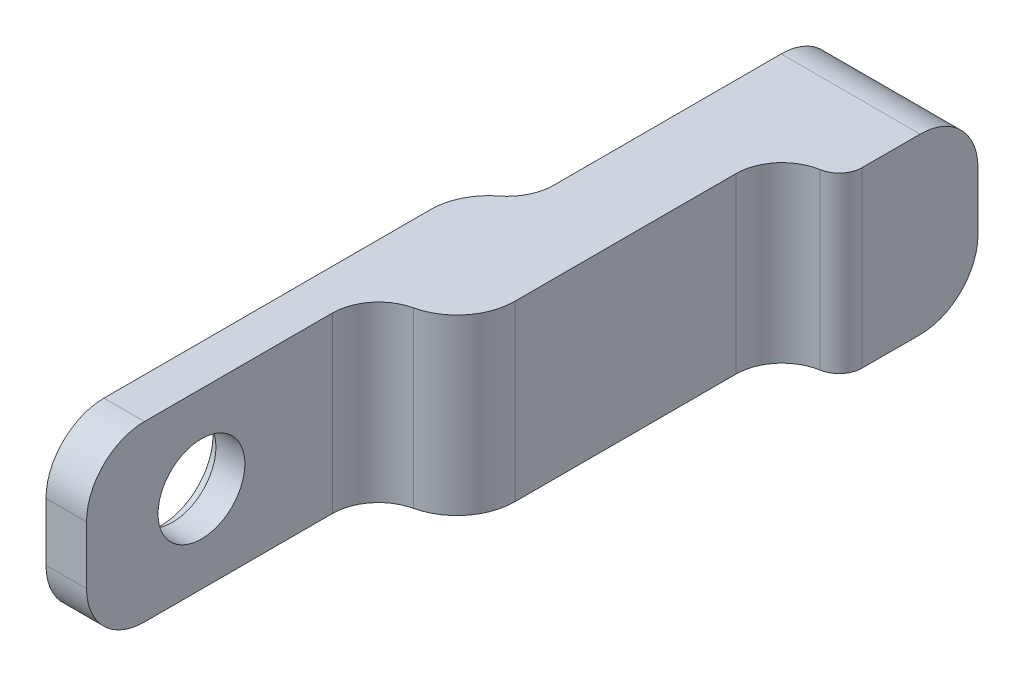
from build123d import *

# Parameters (mm, degrees)
BOSS_EXTRUDE1_DEPTH      = 11
BOSS_EXTRUDE1_DEPTH_BACK = 4
CUT_EXTRUDE1_OUTLINE_R   = 3.25
CUT_EXTRUDE1_DEPTH       = 10
CUT_EXTRUDE3_START       = -3.5
CUT_EXTRUDE3_OUTLINE_R   = 4.5
CUT_EXTRUDE3_DEPTH       = 1
CUT_EXTRUDE4_REACH       = 64.7
SKETCH5_R                = 3.75
CUT_EXTRUDE5_DEPTH       = 2.5
FILLET1_R                = 5
FILLET2_R                = 5
FILLET3_R                = 5
FILLET4_R                = 2
FILLET5_R                = 4
FILLET6_R                = 4


# Read off the part's stored shape, not the designer's step: Cut-Extrude1, Cut-Extrude3
with BuildPart() as part:
    # Sketch2 → Boss-Extrude1 (new, two sides: drawn at the far end of the back side and taken through both)
    with BuildSketch(Plane(origin=(0, 0, 0), x_dir=(1, 0, 0), z_dir=(0, 1, 0)).offset(-BOSS_EXTRUDE1_DEPTH_BACK)):
        Polygon((0, 5), (0, -22), (-3.5, -22), (-3.5, -60), (0, -60), (0, -35), (7, -35), (7, -7), (12, -7), (12, 5), align=None)
    extrude(amount=BOSS_EXTRUDE1_DEPTH + BOSS_EXTRUDE1_DEPTH_BACK)

    # Cut-Extrude1 outline → Cut-Extrude1 (cut)
    with BuildSketch(Plane.YZ):
        with Locations((3.5, 3.5)):
            Circle(CUT_EXTRUDE1_OUTLINE_R)
    extrude(amount=CUT_EXTRUDE1_DEPTH, mode=Mode.SUBTRACT)

    # Cut-Extrude3 outline → Cut-Extrude3 (cut)
    with BuildSketch(Plane.YZ.offset(CUT_EXTRUDE3_START)):
        with Locations((3.5, 50.074977824)):
            Circle(CUT_EXTRUDE3_OUTLINE_R)
    extrude(amount=CUT_EXTRUDE3_DEPTH, mode=Mode.SUBTRACT)

    # Sketch5 → Cut-Extrude4 (cut, up to next)
    with BuildSketch(Plane.ZY.offset(2.5), mode=Mode.PRIVATE) as cut_extrude4_sk1:
        with Locations((50.074977824, 3.5)):
            Circle(SKETCH5_R)
    cut_extrude4_tool1 = extrude(cut_extrude4_sk1.sketch, amount=-CUT_EXTRUDE4_REACH, mode=Mode.PRIVATE) & part.part
    add(cut_extrude4_tool1.solids().sort_by_distance((-2.5, 3.5, 50.074978))[0], mode=Mode.SUBTRACT)

    # Sketch10 → Cut-Extrude5 (cut)
    with BuildSketch(Plane.ZY.offset(3.5)):
        with BuildLine():
            ThreePointArc((41.962487455, 5), (41.859427156, 4.25314489), (41.824977824, 3.5))
            Line((41.824977824, 3.5), (42.824977824, 3.5))
            Line((42.824977824, 3.5), (42.824977824, 5))
            Line((42.824977824, 5), (41.962487455, 5))
        make_face()
        with BuildLine():
            Line((42.824977824, 3.5), (41.824977824, 3.5))
            ThreePointArc((41.824977824, 3.5), (41.859427156, 2.74685511), (41.962487455, 2))
            Line((41.962487455, 2), (42.824977824, 2))
            Line((42.824977824, 2), (42.824977824, 3.5))
        make_face()
    extrude(amount=-CUT_EXTRUDE5_DEPTH, mode=Mode.SUBTRACT)

    # Fillet1
    fillet1_edges = [part.edges().sort_by_distance(p)[0] for p in [
        (6, -4, -5),
        (6, 11, -5),
        (-1.75, -4, 60),
        (-1.75, 11, 60),
    ]]
    fillet(fillet1_edges, radius=FILLET1_R)

    # Fillet2
    # the kernel refuses this fillet: 5 mm, written as the material it takes off along each edge
    with BuildSketch(Plane(origin=(-3.5, -15.924240018, 22), x_dir=(1, 0, 0), z_dir=(0, 1, 0))) as fillet2_piece_1:
        with BuildLine():
            CenterArc((5, -4.769696007), FILLET2_R, 107.457603124, 72.542396876)
            Line((0, -4.769696007), (-0.1, -4.769696007))
            Line((-0.1, -4.769696007), (-0.1, 0))
            Line((-0.1, 0), (0, 0.1))
            ThreePointArc((0, 0.1), (1.75, 0.1), (3.47, 0.09539392))
            Line((3.47, 0.09539392), (3.5, 0))
        make_face()
    extrude(amount=38.848480035, mode=Mode.SUBTRACT)

    # Fillet3
    fillet3_edges = [part.edges().sort_by_distance(p)[0] for p in [
        (7, 3.5, 35),
    ]]
    fillet(fillet3_edges, radius=FILLET3_R)

    # Fillet4
    fillet4_edges = [part.edges().sort_by_distance(p)[0] for p in [
        (12, 3.5, 7),
    ]]
    fillet(fillet4_edges, radius=FILLET4_R)

    # Fillet5
    fillet5_edges = [part.edges().sort_by_distance(p)[0] for p in [
        (7, 3.5, 7),
        (0, 3.5, 35),
    ]]
    fillet(fillet5_edges, radius=FILLET5_R)

    # Fillet6
    fillet6_edges = [part.edges().sort_by_distance(p)[0] for p in [
        (0, 3.5, 22),
    ]]
    fillet(fillet6_edges, radius=FILLET6_R)


solid = part.part
